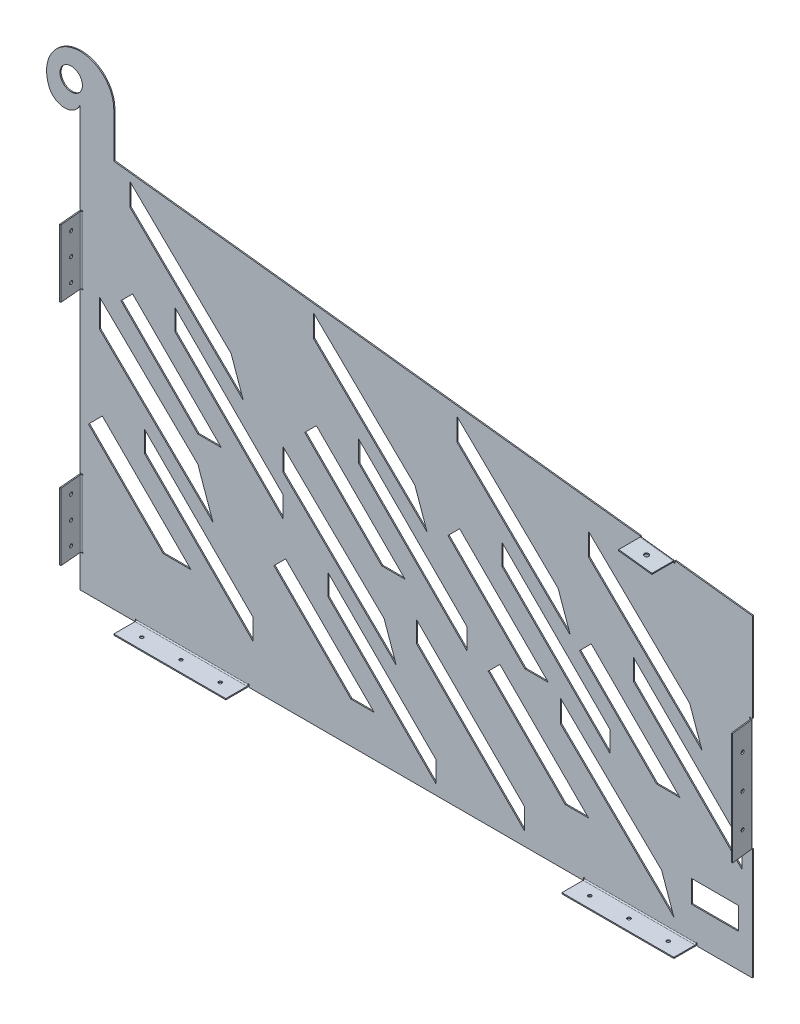
from build123d import *

# Parameters (mm, degrees)
BASE_FLANGE1_DEPTH            = 1
EDGE_FLANGE1_STRIP_W          = 6
EDGE_FLANGE1_STRIP_H          = 1
EDGE_FLANGE1_STRIP_CUT_DEPTH  = 100
EDGE_FLANGE1_RELIEF_W         = 6.5
EDGE_FLANGE1_RELIEF_H         = 0.5
EDGE_FLANGE1_RELIEF_CUT_DEPTH = 1
EDGE_FLANGE1_DEPTH            = 100
EDGE_FLANGE1_PROFILE_W        = 100
EDGE_FLANGE1_PROFILE_H        = 19
EDGE_FLANGE1_PROFILE_R        = 1.5
EDGE_FLANGE1_FLAT_DEPTH       = 1
EDGE_FLANGE2_START            = 29.5
EDGE_FLANGE2_DEPTH            = 61
EDGE_FLANGE2_2_DEPTH          = 0.5
EDGE_FLANGE2_START_2          = 90
EDGE_FLANGE2_3_DEPTH          = 0.5
EDGE_FLANGE2_START_3          = 30
EDGE_FLANGE2_4_DEPTH          = 60
EDGE_FLANGE2_5_OUTLINE_R      = 1.5
EDGE_FLANGE2_5_DEPTH          = 1
CUT_EXTRUDE12_DEPTH           = 10
CUT_EXTRUDE13_DEPTH           = 10
SKETCH44_R                    = 10
CUT_EXTRUDE14_DEPTH           = 10
EDGE_FLANGE3_START            = 99.5
EDGE_FLANGE3_DEPTH            = 101
EDGE_FLANGE3_2_DEPTH          = 0.5
EDGE_FLANGE3_START_2          = 200
EDGE_FLANGE3_3_DEPTH          = 0.5
EDGE_FLANGE3_START_3          = 100
EDGE_FLANGE3_4_DEPTH          = 100
EDGE_FLANGE3_START_4          = 595.083613355
EDGE_FLANGE3_5_OUTLINE_R      = 1.5
EDGE_FLANGE3_5_DEPTH          = 1
EDGE_FLANGE4_STRIP_W          = 6
EDGE_FLANGE4_STRIP_H          = 1
EDGE_FLANGE4_STRIP_CUT_DEPTH  = 30
EDGE_FLANGE4_RELIEF_W         = 6.5
EDGE_FLANGE4_RELIEF_H         = 0.5
EDGE_FLANGE4_RELIEF_CUT_DEPTH = 1
EDGE_FLANGE4_DEPTH            = 30
EDGE_FLANGE4_PROFILE_W        = 30
EDGE_FLANGE4_PROFILE_H        = 19
EDGE_FLANGE4_PROFILE_R        = 2
EDGE_FLANGE4_FLAT_DEPTH       = 1
SKETCH54_W                    = 42
SKETCH54_H                    = 20
CUT_EXTRUDE15_DEPTH           = 10


with BuildPart() as part:
    # Base-Flange1: sheet metal written as solids
    # Sketch1 → Base-Flange1 (new body)
    with BuildSketch(Plane.XY):
        with BuildLine():
            Line((0, 0), (0, 350))
            Line((0, 350), (0, 375))
            ThreePointArc((0, 375), (-13.854151002, 365.75), (-27.708302005, 375))
            ThreePointArc((-27.708302005, 375), (-5.863059775, 415.921497754), (30, 386.5))
            Line((30, 386.5), (30, 346.5))
            Line((30, 346.5), (600, 280))
            Line((600, 280), (600, 0))
            Line((600, 0), (0, 0))
        make_face()
    extrude(amount=-BASE_FLANGE1_DEPTH)

    # Edge-Flange1: sheet metal written as solids
    # Edge-Flange1 strip (on a plane across the edge) → Edge-Flange1 strip cut (cut)
    with BuildSketch(Plane.YZ.offset(450)):
        with Locations((-1, -0.5)):
            Rectangle(EDGE_FLANGE1_STRIP_W, EDGE_FLANGE1_STRIP_H)
    edge_flange1_strip_cut = extrude(amount=EDGE_FLANGE1_STRIP_CUT_DEPTH, mode=Mode.SUBTRACT)

    # Edge-Flange1 relief (on the sheet) → Edge-Flange1 relief cut (cut)
    with BuildSketch(Plane(origin=(450, 2, 0), x_dir=(0, 1, 0), z_dir=(0, 0, 1))):
        with Locations((-2.75, 0.25)):
            Rectangle(EDGE_FLANGE1_RELIEF_W, EDGE_FLANGE1_RELIEF_H)
        with Locations((-2.75, -100.25)):
            Rectangle(EDGE_FLANGE1_RELIEF_W, EDGE_FLANGE1_RELIEF_H)
    edge_flange1_relief_cut = extrude(amount=-EDGE_FLANGE1_RELIEF_CUT_DEPTH, mode=Mode.SUBTRACT)

    # Edge-Flange1 bend section (on a plane across the edge) → Edge-Flange1 (add)
    with BuildSketch(Plane.YZ.offset(450)):
        with BuildLine():
            Line((0, 1), (1, 1))
            ThreePointArc((1, 1), (1.292893219, 0.292893219), (2, 0))
            Line((2, 0), (2, -1))
            ThreePointArc((2, -1), (0.585786438, -0.414213562), (0, 1))
        make_face()
    edge_flange1 = extrude(amount=EDGE_FLANGE1_DEPTH)

    # Edge-Flange1 profile (on flange) → Edge-Flange1 flat (add)
    with BuildSketch(Plane(origin=(0, 0, 0), x_dir=(-1, 0, 0), z_dir=(0, 1, 0))):
        with Locations((-500, 10.5)):
            Rectangle(EDGE_FLANGE1_PROFILE_W, EDGE_FLANGE1_PROFILE_H)
        with Locations((-535, 10)):
            Circle(EDGE_FLANGE1_PROFILE_R, mode=Mode.SUBTRACT)
        with Locations((-465, 10)):
            Circle(EDGE_FLANGE1_PROFILE_R, mode=Mode.SUBTRACT)
        with Locations((-500, 10)):
            Circle(EDGE_FLANGE1_PROFILE_R, mode=Mode.SUBTRACT)
    edge_flange1_flat = extrude(amount=EDGE_FLANGE1_FLAT_DEPTH)

    # Mirror1: Edge-Flange1 strip cut, Edge-Flange1 relief cut, Edge-Flange1, Edge-Flange1 flat across plane
    add(edge_flange1_strip_cut.mirror(Plane(origin=(300, 0, 0), x_dir=(0, 0, 1), z_dir=(1, 0, 0))), mode=Mode.SUBTRACT)
    add(edge_flange1_relief_cut.mirror(Plane(origin=(300, 0, 0), x_dir=(0, 0, 1), z_dir=(1, 0, 0))), mode=Mode.SUBTRACT)
    add(edge_flange1.mirror(Plane(origin=(300, 0, 0), x_dir=(0, 0, 1), z_dir=(1, 0, 0))))
    add(edge_flange1_flat.mirror(Plane(origin=(300, 0, 0), x_dir=(0, 0, 1), z_dir=(1, 0, 0))))

    # Edge-Flange2: read off the stored shape, not the designer's step
    # Edge-Flange2 outline → Edge-Flange2 (cut)
    with BuildSketch(Plane(origin=(0, 0, 0), x_dir=(1, 0, 0), z_dir=(0, 1, 0)).offset(EDGE_FLANGE2_START)):
        with BuildLine():
            ThreePointArc((0.363077531, 0), (1.095128339, 0.732050808), (2.095128339, 1))
            Line((2.095128339, 1), (0, 1))
            Line((0, 1), (0, 0))
            Line((0, 0), (0.363077531, 0))
        make_face()
    edge_flange2 = extrude(amount=EDGE_FLANGE2_DEPTH, mode=Mode.SUBTRACT)

    # Edge-Flange2 2 outline → Edge-Flange2 2 (cut)
    with BuildSketch(Plane(origin=(0, 0, 0), x_dir=(1, 0, 0), z_dir=(0, 1, 0)).offset(EDGE_FLANGE2_START)):
        with BuildLine():
            Line((2.595128339, 0), (2.595128339, 1))
            Line((2.595128339, 1), (2.095128339, 1))
            ThreePointArc((2.095128339, 1), (1.095128339, 0.732050808), (0.363077531, 0))
            Line((0.363077531, 0), (2.595128339, 0))
        make_face()
    edge_flange2_2 = extrude(amount=EDGE_FLANGE2_2_DEPTH, mode=Mode.SUBTRACT)

    # Edge-Flange2 3 outline → Edge-Flange2 3 (cut)
    with BuildSketch(Plane(origin=(0, 0, 0), x_dir=(1, 0, 0), z_dir=(0, 1, 0)).offset(EDGE_FLANGE2_START_2)):
        with BuildLine():
            Line((2.595128339, 0), (2.595128339, 1))
            Line((2.595128339, 1), (2.095128339, 1))
            ThreePointArc((2.095128339, 1), (1.095128339, 0.732050808), (0.363077531, 0))
            Line((0.363077531, 0), (2.595128339, 0))
        make_face()
    edge_flange2_3 = extrude(amount=EDGE_FLANGE2_3_DEPTH, mode=Mode.SUBTRACT)

    # Edge-Flange2 4 outline → Edge-Flange2 4 (add)
    with BuildSketch(Plane(origin=(0, 0, 0), x_dir=(1, 0, 0), z_dir=(0, 1, 0)).offset(EDGE_FLANGE2_START_3)):
        with BuildLine():
            ThreePointArc((1.098933641, -1.087155743), (1.357851002, -0.324409792), (2.095128339, 0))
            Line((2.095128339, 0), (0.363077531, 0))
            ThreePointArc((0.363077531, 0), (0.142536324, -0.567120772), (0.102738942, -1.174311485))
            Line((0.102738942, -1.174311485), (1.750739994, -20.011049705))
            Line((1.750739994, -20.011049705), (2.746934692, -19.923893962))
            Line((2.746934692, -19.923893962), (1.098933641, -1.087155743))
        make_face()
    edge_flange2_4 = extrude(amount=EDGE_FLANGE2_4_DEPTH)

    # Edge-Flange2 5 outline → Edge-Flange2 5 (cut)
    with BuildSketch(Plane(origin=(0, 0, 0), x_dir=(0, 1, 0), z_dir=(0.9961946980917459, 0, -0.0871557427476548))):
        with Locations((80, 10.087488664)):
            Circle(EDGE_FLANGE2_5_OUTLINE_R)
        with Locations((60, 10.087488664)):
            Circle(EDGE_FLANGE2_5_OUTLINE_R)
        with Locations((40, 10.087488664)):
            Circle(EDGE_FLANGE2_5_OUTLINE_R)
    edge_flange2_5 = extrude(amount=EDGE_FLANGE2_5_DEPTH, mode=Mode.SUBTRACT)

    # Mirror2: Edge-Flange2, Edge-Flange2 2, Edge-Flange2 3, Edge-Flange2 4, Edge-Flange2 5 across plane
    add(edge_flange2.mirror(Plane.ZX.offset(161.81)), mode=Mode.SUBTRACT)
    add(edge_flange2_2.mirror(Plane.ZX.offset(161.81)), mode=Mode.SUBTRACT)
    add(edge_flange2_3.mirror(Plane.ZX.offset(161.81)), mode=Mode.SUBTRACT)
    add(edge_flange2_4.mirror(Plane.ZX.offset(161.81)))
    add(edge_flange2_5.mirror(Plane.ZX.offset(161.81)), mode=Mode.SUBTRACT)

    # Sketch41 → Cut-Extrude12 (cut)
    with BuildSketch(Plane(origin=(0, 0, -1), x_dir=(-1, 0, 0), z_dir=(0, 0, -1))):
        Polygon((-154.141239383, 56.252516515), (-57.507077697, 152.886678201), (-57.507077697, 134.096702317), (-154.141239383, 37.462540631), align=None)
        Polygon((-17.242843662, 235.138675289), (-17.242843662, 210.263211702), (-118.574499318, 111.516547261), (-105.040256286, 149.758515319), align=None)
        Polygon((-98.945685226, 65.144201531), (-19.759358289, 144.330528468), (-9.525532138, 134.096702317), (-7.344552794, 131.915722974), (-74.116074237, 65.144201531), align=None)
        Polygon((-590.588759568, 98.27831079), (-493.954597882, 194.912472476), (-493.954597882, 176.183454114), (-590.588759568, 79.549292428), align=None)
        Polygon((-453.690363846, 272.289143861), (-453.690363846, 252.349963498), (-555.022019503, 153.603299057), (-544.151569101, 184.318531234), align=None)
        Polygon((-535.393205411, 107.230953327), (-456.206878473, 186.417280265), (-445.973052323, 176.183454114), (-445.77480592, 175.985207711), (-514.529060304, 107.230953327), align=None)
    extrude(amount=-CUT_EXTRUDE12_DEPTH, mode=Mode.SUBTRACT)

    # Sketch43 → Cut-Extrude13 (cut)
    with BuildSketch(Plane(origin=(0, 0, -1), x_dir=(-1, 0, 0), z_dir=(0, 0, -1))):
        Polygon((-125.988081756, 173.047946542), (-105.123936649, 173.047946542), (-36.369682266, 241.802200926), (-46.801754819, 252.23427348), align=None)
        Polygon((-181.183635914, 164.095304005), (-181.183635914, 145.366285643), (-84.549474228, 242.000447329), (-84.549474228, 260.729465691), align=None)
        Polygon((-134.746445446, 250.135524449), (-145.616895849, 219.420292272), (-44.285240192, 318.166956713), (-44.285240192, 338.106137076), align=None)
        Polygon((-290.064835452, 153.251364808), (-269.200690345, 153.251364808), (-200.446435962, 222.005619192), (-210.878508515, 232.437691745), align=None)
        Polygon((-345.26038961, 144.29872227), (-345.26038961, 125.569703909), (-248.626227924, 222.203865595), (-248.626227924, 240.932883956), align=None)
        Polygon((-298.823199142, 230.338942714), (-309.693649545, 199.623710538), (-208.361993888, 298.370374979), (-208.361993888, 318.309555342), align=None)
        Polygon((-262.550942194, 36.485086104), (-241.686797088, 36.485086104), (-172.932542704, 105.239340488), (-183.364615257, 115.671413041), align=None)
        Polygon((-317.746496352, 27.532443566), (-317.746496352, 8.803425205), (-221.112334666, 105.437586891), (-221.112334666, 124.166605252), align=None)
        Polygon((-271.309305885, 113.57266401), (-282.179756287, 82.857431834), (-180.84810063, 181.604096275), (-180.84810063, 201.543276638), align=None)
        Polygon((-417.903778516, 137.481206477), (-397.039633409, 137.481206477), (-328.285379025, 206.235460861), (-338.717451579, 216.667533415), align=None)
        Polygon((-473.099332674, 128.52856394), (-473.099332674, 109.799545578), (-376.465170988, 206.433707264), (-376.465170988, 225.162725626), align=None)
        Polygon((-426.662142206, 214.568784384), (-437.532592609, 183.853552207), (-336.200936952, 282.600216648), (-336.200936952, 302.539397011), align=None)
        Polygon((-453.858581835, 50.577429245), (-432.994436728, 50.577429245), (-364.240182344, 119.331683629), (-374.672254897, 129.763756183), align=None)
        Polygon((-396.804931373, 30.703925494), (-396.804931373, 11.974907133), (-300.170769687, 108.609068819), (-300.170769687, 127.33808718), align=None)
        Polygon((-519.093580354, 42.822261683), (-529.964030757, 12.107029506), (-428.6323751, 110.853693948), (-428.6323751, 130.792874311), align=None)
    extrude(amount=-CUT_EXTRUDE13_DEPTH, mode=Mode.SUBTRACT)

    # Sketch44 → Cut-Extrude14 (cut)
    with BuildSketch(Plane(origin=(0, 0, -1), x_dir=(-1, 0, 0), z_dir=(0, 0, -1))):
        with Locations((8.02, 391)):
            Circle(SKETCH44_R)
    extrude(amount=-CUT_EXTRUDE14_DEPTH, mode=Mode.SUBTRACT)

    # Edge-Flange3: read off the stored shape, not the designer's step
    # Edge-Flange3 outline → Edge-Flange3 (cut)
    with BuildSketch(Plane(origin=(0, 0, 0), x_dir=(1, 0, 0), z_dir=(0, 1, 0)).offset(EDGE_FLANGE3_START)):
        with BuildLine():
            Line((600, 1), (598.101679296, 1))
            ThreePointArc((598.101679296, 1), (599.101679296, 0.732050807), (599.833730103, 0))
            Line((599.833730103, 0), (600, 0))
            Line((600, 0), (600, 1))
        make_face()
    extrude(amount=EDGE_FLANGE3_DEPTH, mode=Mode.SUBTRACT)

    # Edge-Flange3 2 outline → Edge-Flange3 2 (cut)
    with BuildSketch(Plane(origin=(0, 0, 0), x_dir=(1, 0, 0), z_dir=(0, 1, 0)).offset(EDGE_FLANGE3_START)):
        with BuildLine():
            Line((597.601679296, 1), (597.601679296, 0))
            Line((597.601679296, 0), (599.833730103, 0))
            ThreePointArc((599.833730103, 0), (599.101679296, 0.732050807), (598.101679296, 1))
            Line((598.101679296, 1), (597.601679296, 1))
        make_face()
    extrude(amount=EDGE_FLANGE3_2_DEPTH, mode=Mode.SUBTRACT)

    # Edge-Flange3 3 outline → Edge-Flange3 3 (cut)
    with BuildSketch(Plane(origin=(0, 0, 0), x_dir=(1, 0, 0), z_dir=(0, 1, 0)).offset(EDGE_FLANGE3_START_2)):
        with BuildLine():
            Line((597.601679296, 1), (597.601679296, 0))
            Line((597.601679296, 0), (599.833730103, 0))
            ThreePointArc((599.833730103, 0), (599.101679296, 0.732050807), (598.101679296, 1))
            Line((598.101679296, 1), (597.601679296, 1))
        make_face()
    extrude(amount=EDGE_FLANGE3_3_DEPTH, mode=Mode.SUBTRACT)

    # Edge-Flange3 4 outline → Edge-Flange3 4 (add)
    with BuildSketch(Plane(origin=(0, 0, 0), x_dir=(1, 0, 0), z_dir=(0, 1, 0)).offset(EDGE_FLANGE3_START_3)):
        with BuildLine():
            Line((599.833730103, 0), (598.101679296, 0))
            ThreePointArc((598.101679296, 0), (598.767235369, -0.25365215), (599.095151985, -0.885929774))
            Line((599.095151985, -0.885929774), (601.274834315, -19.869453778))
            Line((601.274834315, -19.869453778), (602.268307003, -19.755383553))
            Line((602.268307003, -19.755383553), (600.088624674, -0.771859549))
            ThreePointArc((600.088624674, -0.771859549), (600.00080408, -0.372843678), (599.833730103, 0))
        make_face()
    extrude(amount=EDGE_FLANGE3_4_DEPTH)

    # Edge-Flange3 5 outline → Edge-Flange3 5 (cut)
    with BuildSketch(Plane(origin=(0, 0, 0), x_dir=(0, 1, 0), z_dir=(0.9934726889248264, 0, -0.11407022556511005)).offset(EDGE_FLANGE3_START_4)):
        with Locations((120, 78.32731565)):
            Circle(EDGE_FLANGE3_5_OUTLINE_R)
        with Locations((150, 78.32731565)):
            Circle(EDGE_FLANGE3_5_OUTLINE_R)
        with Locations((180, 78.32731565)):
            Circle(EDGE_FLANGE3_5_OUTLINE_R)
    extrude(amount=EDGE_FLANGE3_5_DEPTH, mode=Mode.SUBTRACT)

    # Edge-Flange4: sheet metal written as solids
    # Edge-Flange4 strip (on a plane across the edge) → Edge-Flange4 strip cut (cut)
    with BuildSketch(Plane(origin=(530.471580264, 288.111648969, 0), x_dir=(-0.11588069956017832, -0.9932631390872431, 3.4914813388431334e-15), z_dir=(-0.9932631390872431, 0.11588069956017832, 0))):
        with Locations((-1, -0.5)):
            Rectangle(EDGE_FLANGE4_STRIP_W, EDGE_FLANGE4_STRIP_H)
    extrude(amount=EDGE_FLANGE4_STRIP_CUT_DEPTH, mode=Mode.SUBTRACT)

    # Edge-Flange4 relief (on the sheet) → Edge-Flange4 relief cut (cut)
    with BuildSketch(Plane(origin=(530.239818865, 286.125122691, 0), x_dir=(-0.11588069956017832, -0.9932631390872431, 6.982962677686267e-15), z_dir=(0, 0, 1))):
        with Locations((-2.75, 0.25)):
            Rectangle(EDGE_FLANGE4_RELIEF_W, EDGE_FLANGE4_RELIEF_H)
        with Locations((-2.75, -30.25)):
            Rectangle(EDGE_FLANGE4_RELIEF_W, EDGE_FLANGE4_RELIEF_H)
    extrude(amount=-EDGE_FLANGE4_RELIEF_CUT_DEPTH, mode=Mode.SUBTRACT)

    # Edge-Flange4 bend section (on a plane across the edge) → Edge-Flange4 (add)
    with BuildSketch(Plane(origin=(530.471580264, 288.111648969, 0), x_dir=(-0.11588069956017832, -0.9932631390872431, 3.4914813388431334e-15), z_dir=(-0.9932631390872431, 0.11588069956017832, 0))):
        with BuildLine():
            Line((0, 1), (1, 1))
            ThreePointArc((1, 1), (1.292893219, 0.292893219), (2, 0))
            Line((2, 0), (2, -1))
            ThreePointArc((2, -1), (0.585786438, -0.414213562), (0, 1))
        make_face()
    extrude(amount=EDGE_FLANGE4_DEPTH)

    # Edge-Flange4 profile (on flange) → Edge-Flange4 flat (add)
    with BuildSketch(Plane(origin=(40.285009592, 345.300082214, 0), x_dir=(0.993263139087243, -0.11588069956017831, 0), z_dir=(-0.11588069956017832, -0.9932631390872431, 3.4914813388431334e-15))):
        with Locations((478.511287575, 10.5)):
            Rectangle(EDGE_FLANGE4_PROFILE_W, EDGE_FLANGE4_PROFILE_H)
        with Locations((478.511287575, 10)):
            Circle(EDGE_FLANGE4_PROFILE_R, mode=Mode.SUBTRACT)
    extrude(amount=EDGE_FLANGE4_FLAT_DEPTH)

    # Sketch54 → Cut-Extrude15 (cut)
    with BuildSketch(Plane(origin=(0, 0, -1), x_dir=(-1, 0, 0), z_dir=(0, 0, -1))):
        with Locations((-566.659197365, 39.88657382)):
            Rectangle(SKETCH54_W, SKETCH54_H)
    extrude(amount=-CUT_EXTRUDE15_DEPTH, mode=Mode.SUBTRACT)


solid = part.part
